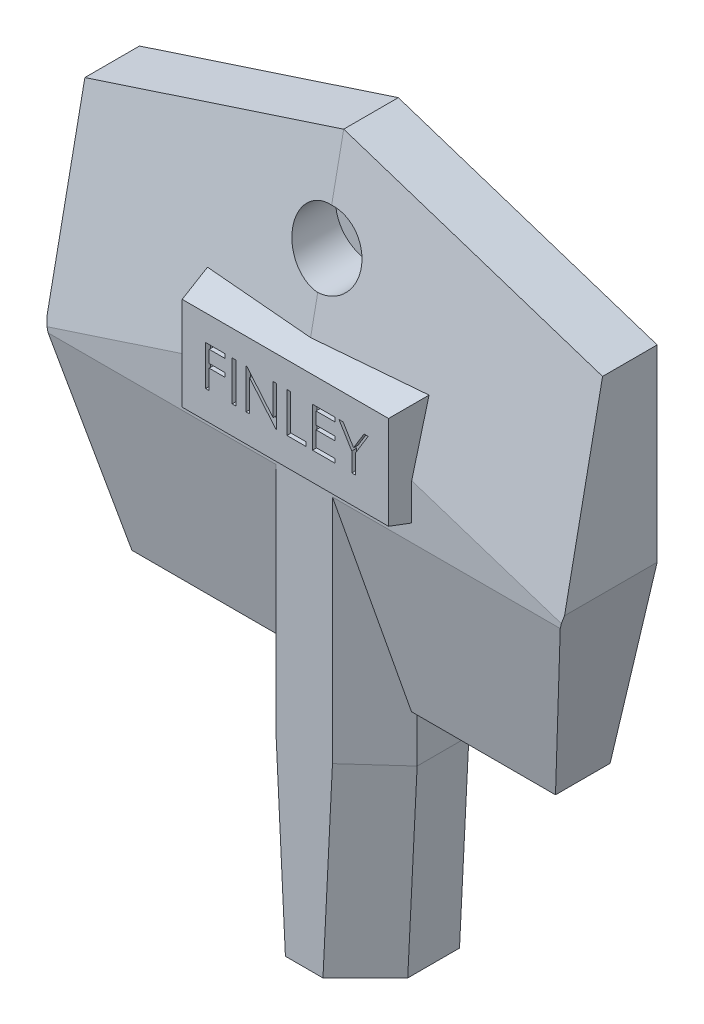
from build123d import *

# Parameters (mm, degrees)
BOSS_EXTRUDE1_DEPTH  = 10
SKETCH3_OUTSIDE_W    = 75.708
SKETCH3_OUTSIDE_H    = 95.708
SHAPE_CUTS_DEPTH     = 58.933151131
DOVE_TAIL_DEPTH      = 30
SKETCH5_R            = 2.05
FASTENER_DEPTH       = 58.933151131
SKETCH7_R            = 3.65
CUT_EXTRUDE4_DEPTH   = 7
SKETCH8_W            = 24
SKETCH8_H            = 12
NAMES_PLATE_DEPTH    = 2
CHAMFER1_SIZE        = 4.2
CHAMFER1_SIZE_2      = 19.75944646
CHAMFER2_SIZE        = 4.5
CHAMFER3_SIZE        = 4.5
CHAMFER3_SIZE_2      = 1.03890686
SKETCH9_W            = 0.379914529
SKETCH9_H            = 4.233333333
AVA_NAME_PRINT_DEPTH = 0.5


with BuildPart() as part:
    # Sketch2 → Boss-Extrude1 (new body)
    with BuildSketch(Plane.XY):
        Polygon((7.5, 0), (27.5, 0), (27.5, 50), (-27.5, 50), (-27.5, 0), (-7.5, 0), (-7.5, -25), (7.5, -25), align=None)
    extrude(amount=BOSS_EXTRUDE1_DEPTH)

    # Sketch3 outside → Shape cuts (cut, through all)
    with BuildSketch(Plane.XY.offset(10)):
        with Locations((0, 12.5)):
            Rectangle(SKETCH3_OUTSIDE_W, SKETCH3_OUTSIDE_H)
        Polygon((-6.5, -25), (-7.5, -5), (-7.5, 0), (-22.5, 0), (-27.5, 21), (-27.5, 41), (0, 50), (27.5, 41), (27.5, 21), (22.5, 0), (7.5, 0), (7.5, -5), (6.5, -25), align=None, mode=Mode.SUBTRACT)
    extrude(amount=-SHAPE_CUTS_DEPTH, mode=Mode.SUBTRACT)

    # Sketch4 → Dove tail (cut)
    with BuildSketch(Plane.XZ.offset(25)):
        Polygon((-5, 5), (5, 5), (3, 0), (-3, 0), align=None)
    extrude(amount=-DOVE_TAIL_DEPTH, mode=Mode.SUBTRACT)

    # Sketch5 → Fastener (cut, through all)
    with BuildSketch(Plane(origin=(0, 0, 0), x_dir=(-1, 0, 0), z_dir=(0, 0, -1))):
        with Locations((0, 40)):
            Circle(SKETCH5_R)
    extrude(amount=-FASTENER_DEPTH, mode=Mode.SUBTRACT)

    # Sketch7 → Cut-Extrude4 (cut)
    with BuildSketch(Plane.XY.offset(10)):
        with Locations((0, 40)):
            Circle(SKETCH7_R)
    extrude(amount=-CUT_EXTRUDE4_DEPTH, mode=Mode.SUBTRACT)

    # Sketch8 → Names Plate (add)
    with BuildSketch(Plane.XY.offset(10)):
        with Locations((0, 27)):
            Rectangle(SKETCH8_W, SKETCH8_H)
    extrude(amount=NAMES_PLATE_DEPTH)

    # Chamfer1
    # the kernel refuses this chamfer: 19.75944646, 4.2 mm, written as the material it takes off along each edge
    with BuildSketch(Plane(origin=(-43.83302561, 0, 10), x_dir=(0, -0.17442650951506392, -0.9846701949274139), z_dir=(1, 0, 0))) as chamfer1_piece_1_section:
        Polygon((CHAMFER1_SIZE * 0.984670194927, CHAMFER1_SIZE * 0.174426509515), (-CHAMFER1_SIZE_2 * 0.174426509513, CHAMFER1_SIZE_2 * 0.984670194918), (0, 0), align=None)
    chamfer1_piece_1 = extrude(amount=117.66605122, mode=Mode.PRIVATE)
    chamfer1_piece_1 = split(chamfer1_piece_1, bisect_by=Plane(origin=(-7.5, 6.987243294, 8.814531777), z_dir=(-1, 0, 0)), keep=Keep.TOP, mode=Mode.PRIVATE)
    add(chamfer1_piece_1, mode=Mode.SUBTRACT)
    with BuildSketch(Plane(origin=(7.5, 0, 10), x_dir=(0, -0.17442650951506392, -0.9846701949274139), z_dir=(1, 0, 0))) as chamfer1_piece_2:
        Polygon((CHAMFER1_SIZE * 0.984670194927, CHAMFER1_SIZE * 0.174426509515), (-CHAMFER1_SIZE_2 * 0.174426509513, CHAMFER1_SIZE_2 * 0.984670194918), (0, 0), align=None)
    extrude(amount=66.33302561, mode=Mode.SUBTRACT)
    with BuildSketch(Plane(origin=(-73.83302561, 0, 10), x_dir=(0, 0.9999679748920759, 0.008003073799517023), z_dir=(1, 0, 0))) as chamfer1_piece_3:
        Polygon((CHAMFER1_SIZE_2 * 0.999967974882, -CHAMFER1_SIZE_2 * 0.00800307379944), (-CHAMFER1_SIZE * 0.00800307379952, -CHAMFER1_SIZE * 0.999967974892), (0, 0), align=None)
    extrude(amount=66.33302561, mode=Mode.SUBTRACT)
    with BuildSketch(Plane(origin=(-73.83302561, 0, 10), x_dir=(0, 0.9999679748920759, 0.008003073799517023), z_dir=(1, 0, 0))) as chamfer1_piece_4_section:
        Polygon((CHAMFER1_SIZE_2 * 0.999967974882, -CHAMFER1_SIZE_2 * 0.00800307379944), (-CHAMFER1_SIZE * 0.00800307379952, -CHAMFER1_SIZE * 0.999967974892), (0, 0), align=None)
    chamfer1_piece_4 = extrude(amount=117.66605122, mode=Mode.PRIVATE)
    chamfer1_piece_4 = split(chamfer1_piece_4, bisect_by=Plane(origin=(7.5, 6.987243294, 8.814531777), z_dir=(1, 0, 0)), keep=Keep.TOP, mode=Mode.PRIVATE)
    add(chamfer1_piece_4, mode=Mode.SUBTRACT)
    with BuildSketch(Plane(origin=(-76.286760165, 25.033423946, 10), x_dir=(0.3110290993551473, -0.9503666924740605, 0.008003073799517025), z_dir=(0.9503971290446889, 0.31103906041462565, 0))) as chamfer1_piece_5_section:
        Polygon((CHAMFER1_SIZE_2 * 0.999967974882, CHAMFER1_SIZE_2 * 0.00800307379944), (-CHAMFER1_SIZE * 0.00800307379952, CHAMFER1_SIZE * 0.999967974892), (0, 0), align=None)
    chamfer1_piece_5 = extrude(amount=131.601323812, mode=Mode.PRIVATE)
    chamfer1_piece_5 = split(chamfer1_piece_5, bisect_by=Plane(origin=(-50.474654782, 33, 8.986769107), z_dir=(0, -1, 0)), keep=Keep.TOP, mode=Mode.PRIVATE)
    chamfer1_piece_5 = split(chamfer1_piece_5, bisect_by=Plane(origin=(-12, 24.582378236, 8.986769107), z_dir=(-1, 0, 0)), keep=Keep.TOP, mode=Mode.PRIVATE)
    add(chamfer1_piece_5, mode=Mode.SUBTRACT)
    with BuildSketch(Plane(origin=(-76.286760165, 25.033423946, 10), x_dir=(0.3110290993551473, -0.9503666924740605, 0.008003073799517025), z_dir=(0.9503971290446889, 0.31103906041462565, 0))) as chamfer1_piece_6_section:
        Polygon((CHAMFER1_SIZE_2 * 0.999967974882, CHAMFER1_SIZE_2 * 0.00800307379944), (-CHAMFER1_SIZE * 0.00800307379952, CHAMFER1_SIZE * 0.999967974892), (0, 0), align=None)
    chamfer1_piece_6 = extrude(amount=131.601323812, mode=Mode.PRIVATE)
    chamfer1_piece_6 = split(chamfer1_piece_6, bisect_by=Plane(origin=(-26.699133226, 33, 8.380574439), z_dir=(0, 1, 0)), keep=Keep.TOP, mode=Mode.PRIVATE)
    chamfer1_piece_6 = split(chamfer1_piece_6, bisect_by=Plane(origin=(-12, 37.810625419, 8.380574439), z_dir=(-1, 0, 0)), keep=Keep.TOP, mode=Mode.PRIVATE)
    add(chamfer1_piece_6, mode=Mode.SUBTRACT)
    with BuildSketch(Plane(origin=(-76.286760165, 25.033423946, 10), x_dir=(0.3110290993551473, -0.9503666924740605, 0.008003073799517025), z_dir=(0.9503971290446889, 0.31103906041462565, 0))) as chamfer1_piece_7_section:
        Polygon((CHAMFER1_SIZE_2 * 0.999967974882, CHAMFER1_SIZE_2 * 0.00800307379944), (-CHAMFER1_SIZE * 0.00800307379952, CHAMFER1_SIZE * 0.999967974892), (0, 0), align=None)
    chamfer1_piece_7 = extrude(amount=131.601323812, mode=Mode.PRIVATE)
    chamfer1_piece_7 = split(chamfer1_piece_7, bisect_by=Plane(origin=(20.226611315, 33, 8.796706838), z_dir=(0, 1, 0)), keep=Keep.TOP, mode=Mode.PRIVATE)
    chamfer1_piece_7 = split(chamfer1_piece_7, bisect_by=Plane(origin=(-12, 49.436791762, 8.796706838), z_dir=(1, 0, 0)), keep=Keep.TOP, mode=Mode.PRIVATE)
    add(chamfer1_piece_7, mode=Mode.SUBTRACT)
    with BuildSketch(Plane(origin=(-48.786760165, 65.966576054, 10), x_dir=(-0.3110290993551472, -0.9503666924740605, 0.008003073799517025), z_dir=(0.9503971290446889, -0.31103906041462565, 0))) as chamfer1_piece_8_section:
        Polygon((CHAMFER1_SIZE_2 * 0.999967974882, CHAMFER1_SIZE_2 * 0.00800307379944), (-CHAMFER1_SIZE * 0.00800307379952, CHAMFER1_SIZE * 0.999967974892), (0, 0), align=None)
    chamfer1_piece_8 = extrude(amount=131.601323812, mode=Mode.PRIVATE)
    chamfer1_piece_8 = split(chamfer1_piece_8, bisect_by=Plane(origin=(12, 49.436791762, 8.796706838), z_dir=(-1, 0, 0)), keep=Keep.TOP, mode=Mode.PRIVATE)
    chamfer1_piece_8 = split(chamfer1_piece_8, bisect_by=Plane(origin=(-20.226611315, 33, 8.796706838), z_dir=(0, 1, 0)), keep=Keep.TOP, mode=Mode.PRIVATE)
    add(chamfer1_piece_8, mode=Mode.SUBTRACT)
    with BuildSketch(Plane(origin=(-48.786760165, 65.966576054, 10), x_dir=(-0.3110290993551472, -0.9503666924740605, 0.008003073799517025), z_dir=(0.9503971290446889, -0.31103906041462565, 0))) as chamfer1_piece_9_section:
        Polygon((CHAMFER1_SIZE_2 * 0.999967974882, CHAMFER1_SIZE_2 * 0.00800307379944), (-CHAMFER1_SIZE * 0.00800307379952, CHAMFER1_SIZE * 0.999967974892), (0, 0), align=None)
    chamfer1_piece_9 = extrude(amount=131.601323812, mode=Mode.PRIVATE)
    chamfer1_piece_9 = split(chamfer1_piece_9, bisect_by=Plane(origin=(12, 37.810625419, 8.380574439), z_dir=(1, 0, 0)), keep=Keep.TOP, mode=Mode.PRIVATE)
    chamfer1_piece_9 = split(chamfer1_piece_9, bisect_by=Plane(origin=(26.699133226, 33, 8.380574439), z_dir=(0, 1, 0)), keep=Keep.TOP, mode=Mode.PRIVATE)
    add(chamfer1_piece_9, mode=Mode.SUBTRACT)
    with BuildSketch(Plane(origin=(-48.786760165, 65.966576054, 10), x_dir=(-0.3110290993551472, -0.9503666924740605, 0.008003073799517025), z_dir=(0.9503971290446889, -0.31103906041462565, 0))) as chamfer1_piece_10_section:
        Polygon((CHAMFER1_SIZE_2 * 0.999967974882, CHAMFER1_SIZE_2 * 0.00800307379944), (-CHAMFER1_SIZE * 0.00800307379952, CHAMFER1_SIZE * 0.999967974892), (0, 0), align=None)
    chamfer1_piece_10 = extrude(amount=131.601323812, mode=Mode.PRIVATE)
    chamfer1_piece_10 = split(chamfer1_piece_10, bisect_by=Plane(origin=(12, 24.582378236, 8.986769107), z_dir=(1, 0, 0)), keep=Keep.TOP, mode=Mode.PRIVATE)
    chamfer1_piece_10 = split(chamfer1_piece_10, bisect_by=Plane(origin=(50.474654782, 33, 8.986769107), z_dir=(0, -1, 0)), keep=Keep.TOP, mode=Mode.PRIVATE)
    add(chamfer1_piece_10, mode=Mode.SUBTRACT)

    # Chamfer2
    # the kernel refuses this chamfer: 4.5 mm, written as the material it adds along each edge
    # the kernel refuses this chamfer: 4.5 mm, written as the material it takes off along each edge
    with BuildSketch(Plane(origin=(-7.5, 31.332019906, 10), x_dir=(0.9996219169112966, 8.91002913121734e-15, 0.02749587661058639), z_dir=(0, -1, 0))) as chamfer2_2_piece_1_section:
        Polygon((CHAMFER2_SIZE * 0.999621916911, -CHAMFER2_SIZE * 0.0274958766106), (-CHAMFER2_SIZE * 0.0274958766106, -CHAMFER2_SIZE * 0.999621916911), (0, 0), align=None)
    chamfer2_2_piece_1 = extrude(amount=47.904593352, mode=Mode.PRIVATE)
    chamfer2_2_piece_1 = split(chamfer2_2_piece_1, bisect_by=Plane(origin=(-7.425, 0, 5.65), z_dir=(0, -1, 0)), keep=Keep.TOP, mode=Mode.PRIVATE)
    add(chamfer2_2_piece_1, mode=Mode.SUBTRACT)
    with BuildSketch(Plane(origin=(-7.5, 31.332019906, 10), x_dir=(0.9996219169112966, 8.91002913121734e-15, 0.02749587661058639), z_dir=(0, -1, 0))) as chamfer2_2_piece_2_section:
        Polygon((CHAMFER2_SIZE * 0.999621916911, -CHAMFER2_SIZE * 0.0274958766106), (-CHAMFER2_SIZE * 0.0274958766106, -CHAMFER2_SIZE * 0.999621916911), (0, 0), align=None)
    chamfer2_2_piece_2 = extrude(amount=47.904593352, mode=Mode.PRIVATE)
    chamfer2_2_piece_2 = split(chamfer2_2_piece_2, bisect_by=Plane(origin=(-5.791935484, 7.646978201, 7.425415393), z_dir=(0, -0.20791169081730007, 0.9781476007339034)), keep=Keep.TOP, mode=Mode.PRIVATE)
    add(chamfer2_2_piece_2, mode=Mode.SUBTRACT)
    with BuildSketch(Plane(origin=(7.5, 31.332019906, 10), x_dir=(0.02749587661058639, 1.490299200723227e-13, -0.9996219169112966), z_dir=(0, -1, 0))) as chamfer2_2_piece_3_section:
        Polygon((CHAMFER2_SIZE * 0.999621916911, -CHAMFER2_SIZE * 0.0274958766106), (-CHAMFER2_SIZE * 0.0274958766106, -CHAMFER2_SIZE * 0.999621916911), (0, 0), align=None)
    chamfer2_2_piece_3 = extrude(amount=47.904593351, mode=Mode.PRIVATE)
    chamfer2_2_piece_3 = split(chamfer2_2_piece_3, bisect_by=Plane(origin=(5.791935484, 7.646978201, 7.425415393), z_dir=(0, -0.20791169081730007, 0.9781476007339034)), keep=Keep.TOP, mode=Mode.PRIVATE)
    add(chamfer2_2_piece_3, mode=Mode.SUBTRACT)
    with BuildSketch(Plane(origin=(7.5, 31.332019906, 10), x_dir=(0.02749587661058639, 1.490299200723227e-13, -0.9996219169112966), z_dir=(0, -1, 0))) as chamfer2_2_piece_4_section:
        Polygon((CHAMFER2_SIZE * 0.999621916911, -CHAMFER2_SIZE * 0.0274958766106), (-CHAMFER2_SIZE * 0.0274958766106, -CHAMFER2_SIZE * 0.999621916911), (0, 0), align=None)
    chamfer2_2_piece_4 = extrude(amount=47.904593351, mode=Mode.PRIVATE)
    chamfer2_2_piece_4 = split(chamfer2_2_piece_4, bisect_by=Plane(origin=(7.425, 0, 5.65), z_dir=(0, -1, 0)), keep=Keep.TOP, mode=Mode.PRIVATE)
    add(chamfer2_2_piece_4, mode=Mode.SUBTRACT)
    with BuildSketch(Plane(origin=(-5.92209326, -36.558134796, 10), x_dir=(0.9983747275087121, 0.04991873637543544, 0.02749587661058639), z_dir=(-0.049937616943892066, 0.9987523388778448, 0))) as chamfer2_2_piece_5_section:
        Polygon((CHAMFER2_SIZE * 0.999621916911, CHAMFER2_SIZE * 0.0274958766106), (-CHAMFER2_SIZE * 0.0274958766106, CHAMFER2_SIZE * 0.999621916911), (0, 0), align=None)
    chamfer2_2_piece_5 = extrude(amount=43.170131286, mode=Mode.PRIVATE)
    chamfer2_2_piece_5 = split(chamfer2_2_piece_5, bisect_by=Plane(origin=(-5.601535176, -11.523039788, 3.350702283), z_dir=(0, -0.20791169081730007, 0.9781476007339034)), keep=Keep.TOP, mode=Mode.PRIVATE)
    add(chamfer2_2_piece_5, mode=Mode.SUBTRACT)
    with BuildSketch(Plane(origin=(-5.92209326, -36.558134796, 10), x_dir=(0.9983747275087121, 0.04991873637543544, 0.02749587661058639), z_dir=(-0.049937616943892066, 0.9987523388778448, 0))) as chamfer2_2_piece_6_section:
        Polygon((CHAMFER2_SIZE * 0.999621916911, CHAMFER2_SIZE * 0.0274958766106), (-CHAMFER2_SIZE * 0.0274958766106, CHAMFER2_SIZE * 0.999621916911), (0, 0), align=None)
    chamfer2_2_piece_6 = extrude(amount=43.170131286, mode=Mode.PRIVATE)
    chamfer2_2_piece_6 = split(chamfer2_2_piece_6, bisect_by=Plane(origin=(-7.487406309, 0, 5.770981551), z_dir=(0, -1, 0)), keep=Keep.TOP, mode=Mode.PRIVATE)
    add(chamfer2_2_piece_6, mode=Mode.SUBTRACT)
    with BuildSketch(Plane(origin=(8.07790674, 6.558134796, 10), x_dir=(-0.9983747275087121, 0.04991873637543566, 0.02749587661058639), z_dir=(-0.04993761694389229, -0.9987523388778448, 0))) as chamfer2_2_piece_7_section:
        Polygon((CHAMFER2_SIZE * 0.999621916911, CHAMFER2_SIZE * 0.0274958766106), (-CHAMFER2_SIZE * 0.0274958766106, CHAMFER2_SIZE * 0.999621916911), (0, 0), align=None)
    chamfer2_2_piece_7 = extrude(amount=43.170131286, mode=Mode.PRIVATE)
    chamfer2_2_piece_7 = split(chamfer2_2_piece_7, bisect_by=Plane(origin=(6.100176862, 3.64296483, 6.574336079), z_dir=(0, -0.20791169081730007, 0.9781476007339034)), keep=Keep.TOP, mode=Mode.PRIVATE)
    add(chamfer2_2_piece_7, mode=Mode.SUBTRACT)
    with BuildSketch(Plane(origin=(8.07790674, 6.558134796, 10), x_dir=(-0.9983747275087121, 0.04991873637543566, 0.02749587661058639), z_dir=(-0.04993761694389229, -0.9987523388778448, 0))) as chamfer2_2_piece_8_section:
        Polygon((CHAMFER2_SIZE * 0.999621916911, CHAMFER2_SIZE * 0.0274958766106), (-CHAMFER2_SIZE * 0.0274958766106, CHAMFER2_SIZE * 0.999621916911), (0, 0), align=None)
    chamfer2_2_piece_8 = extrude(amount=43.170131286, mode=Mode.PRIVATE)
    chamfer2_2_piece_8 = split(chamfer2_2_piece_8, bisect_by=Plane(origin=(7.487406309, 0, 5.770981551), z_dir=(0, -1, 0)), keep=Keep.TOP, mode=Mode.PRIVATE)
    add(chamfer2_2_piece_8, mode=Mode.SUBTRACT)

    # Chamfer3
    # the kernel refuses this chamfer: 4.5, 1.03890686 mm, written as the material it takes off along each edge
    with BuildSketch(Plane(origin=(-23.688904863, 33, 12), x_dir=(0, 0.008660176093277927, -0.9999624999718906), z_dir=(1, 0, 0))) as chamfer3_piece_1_section:
        Polygon((CHAMFER3_SIZE * 0.999962499972, -CHAMFER3_SIZE * 0.00866017609328), (-CHAMFER3_SIZE_2 * 0.00866017609382, -CHAMFER3_SIZE_2 * 0.999962500034), (0, 0), align=None)
    chamfer3_piece_1 = extrude(amount=47.377809727, mode=Mode.PRIVATE)
    chamfer3_piece_1 = split(chamfer3_piece_1, bisect_by=Plane(origin=(-15.747387657, 32.981610324, 10.27905167), z_dir=(-0.06466865696139155, -0.19759867404852308, -0.9781476007336907)), keep=Keep.TOP, mode=Mode.PRIVATE)
    chamfer3_piece_1 = split(chamfer3_piece_1, bisect_by=Plane(origin=(-15.724323898, 32.577762011, 8.279932697), z_dir=(-0.06466865696139155, 0.19759867404852308, 0.9781476007336907)), keep=Keep.TOP, mode=Mode.PRIVATE)
    add(chamfer3_piece_1, mode=Mode.SUBTRACT)
    with BuildSketch(Plane(origin=(-23.688904863, 33, 12), x_dir=(0, 0.008660176093277927, -0.9999624999718906), z_dir=(1, 0, 0))) as chamfer3_piece_2_section:
        Polygon((CHAMFER3_SIZE * 0.999962499972, -CHAMFER3_SIZE * 0.00866017609328), (-CHAMFER3_SIZE_2 * 0.00866017609382, -CHAMFER3_SIZE_2 * 0.999962500034), (0, 0), align=None)
    chamfer3_piece_2 = extrude(amount=47.377809727, mode=Mode.PRIVATE)
    chamfer3_piece_2 = split(chamfer3_piece_2, bisect_by=Plane(origin=(15.724323898, 32.577762011, 8.279932697), z_dir=(0.06466865696139155, 0.19759867404852308, 0.9781476007336907)), keep=Keep.TOP, mode=Mode.PRIVATE)
    chamfer3_piece_2 = split(chamfer3_piece_2, bisect_by=Plane(origin=(15.747387657, 32.981610324, 10.27905167), z_dir=(0.06466865696139155, -0.19759867404852308, -0.9781476007336907)), keep=Keep.TOP, mode=Mode.PRIVATE)
    add(chamfer3_piece_2, mode=Mode.SUBTRACT)
    with BuildSketch(Plane(origin=(-23.688904863, 33, 12), x_dir=(0, 0.008660176093277927, -0.9999624999718906), z_dir=(1, 0, 0))) as chamfer3_piece_3_section:
        Polygon((CHAMFER3_SIZE * 0.999962499972, -CHAMFER3_SIZE * 0.00866017609328), (-CHAMFER3_SIZE_2 * 0.00866017609382, -CHAMFER3_SIZE_2 * 0.999962500034), (0, 0), align=None)
    chamfer3_piece_3 = extrude(amount=47.377809727, mode=Mode.PRIVATE)
    chamfer3_piece_3 = split(chamfer3_piece_3, bisect_by=Plane(origin=(-0.116574835, 32.257698924, 9.391885215), z_dir=(0.06466865696139155, 0.19759867404852308, 0.9781476007336907)), keep=Keep.TOP, mode=Mode.PRIVATE)
    chamfer3_piece_3 = split(chamfer3_piece_3, bisect_by=Plane(origin=(0.116574835, 32.257698924, 9.391885215), z_dir=(-0.06466865696139155, 0.19759867404852308, 0.9781476007336907)), keep=Keep.TOP, mode=Mode.PRIVATE)
    add(chamfer3_piece_3, mode=Mode.SUBTRACT)
    with BuildSketch(Plane(origin=(12, 44.688904863, 12), x_dir=(-0.9870549888826571, 0, 0.1603821963992814), z_dir=(0, -1, 0))) as chamfer3_piece_4_section:
        Polygon((CHAMFER3_SIZE_2 * 0.987054988944, CHAMFER3_SIZE_2 * 0.160382196409), (-CHAMFER3_SIZE * 0.160382196399, CHAMFER3_SIZE * 0.987054988883), (0, 0), align=None)
    chamfer3_piece_4 = extrude(amount=35.377809727, mode=Mode.PRIVATE)
    chamfer3_piece_4 = split(chamfer3_piece_4, bisect_by=Plane(origin=(11.440207801, 31.525379387, 8.775765274), z_dir=(0.06466865696139155, 0.19759867404852308, 0.9781476007336907)), keep=Keep.TOP, mode=Mode.PRIVATE)
    chamfer3_piece_4 = split(chamfer3_piece_4, bisect_by=Plane(origin=(11.602096163, 32.020038273, 10), z_dir=(0, 0, 1)), keep=Keep.TOP, mode=Mode.PRIVATE)
    add(chamfer3_piece_4, mode=Mode.SUBTRACT)
    with BuildSketch(Plane(origin=(12, 44.688904863, 12), x_dir=(-0.9870549888826571, 0, 0.1603821963992814), z_dir=(0, -1, 0))) as chamfer3_piece_5_section:
        Polygon((CHAMFER3_SIZE_2 * 0.987054988944, CHAMFER3_SIZE_2 * 0.160382196409), (-CHAMFER3_SIZE * 0.160382196399, CHAMFER3_SIZE * 0.987054988883), (0, 0), align=None)
    chamfer3_piece_5 = extrude(amount=35.377809727, mode=Mode.PRIVATE)
    chamfer3_piece_5 = split(chamfer3_piece_5, bisect_by=Plane(origin=(11.75860092, 36.766980835, 7.695842826), z_dir=(0.06466865696139155, 0.19759867404852308, 0.9781476007336907)), keep=Keep.TOP, mode=Mode.PRIVATE)
    chamfer3_piece_5 = split(chamfer3_piece_5, bisect_by=Plane(origin=(11.856026743, 37.064670851, 10), z_dir=(0, 0, -1)), keep=Keep.TOP, mode=Mode.PRIVATE)
    add(chamfer3_piece_5, mode=Mode.SUBTRACT)
    with BuildSketch(Plane(origin=(12, 44.688904863, 12), x_dir=(-0.9870549888826571, 0, 0.1603821963992814), z_dir=(0, -1, 0))) as chamfer3_piece_6_section:
        Polygon((CHAMFER3_SIZE_2 * 0.987054988944, CHAMFER3_SIZE_2 * 0.160382196409), (-CHAMFER3_SIZE * 0.160382196399, CHAMFER3_SIZE * 0.987054988883), (0, 0), align=None)
    chamfer3_piece_6 = extrude(amount=35.377809727, mode=Mode.PRIVATE)
    chamfer3_piece_6 = split(chamfer3_piece_6, bisect_by=Plane(origin=(11.705305569, 15.149533813, 12.066374843), z_dir=(-0.06466865696139155, -0.19759867404852308, -0.9781476007336907)), keep=Keep.TOP, mode=Mode.PRIVATE)
    chamfer3_piece_6 = split(chamfer3_piece_6, bisect_by=Plane(origin=(11.633502975, 14.930136998, 10), z_dir=(0, 0, 1)), keep=Keep.TOP, mode=Mode.PRIVATE)
    add(chamfer3_piece_6, mode=Mode.SUBTRACT)
    with BuildSketch(Plane(origin=(23.688904863, 21, 12), x_dir=(0, -0.008660176093277927, -0.9999624999718906), z_dir=(-1, 0, 0))) as chamfer3_piece_7_section:
        Polygon((CHAMFER3_SIZE * 0.999962499972, -CHAMFER3_SIZE * 0.00866017609328), (-CHAMFER3_SIZE_2 * 0.00866017609382, -CHAMFER3_SIZE_2 * 0.999962500034), (0, 0), align=None)
    chamfer3_piece_7 = extrude(amount=47.377809727, mode=Mode.PRIVATE)
    chamfer3_piece_7 = split(chamfer3_piece_7, bisect_by=Plane(origin=(0, 21.388678307, 10), z_dir=(0, 0, 1)), keep=Keep.TOP, mode=Mode.PRIVATE)
    add(chamfer3_piece_7, mode=Mode.SUBTRACT)
    with BuildSketch(Plane(origin=(-12, 9.311095137, 12), x_dir=(-0.008660176093277927, 0, -0.9999624999718906), z_dir=(0, 1, 0))) as chamfer3_piece_8_section:
        Polygon((CHAMFER3_SIZE * 0.999962499972, -CHAMFER3_SIZE * 0.00866017609328), (-CHAMFER3_SIZE_2 * 0.00866017609382, -CHAMFER3_SIZE_2 * 0.999962500034), (0, 0), align=None)
    chamfer3_piece_8 = extrude(amount=35.377809727, mode=Mode.PRIVATE)
    chamfer3_piece_8 = split(chamfer3_piece_8, bisect_by=Plane(origin=(-11.705305569, 15.149533813, 12.066374843), z_dir=(0.06466865696139155, -0.19759867404852308, -0.9781476007336907)), keep=Keep.TOP, mode=Mode.PRIVATE)
    chamfer3_piece_8 = split(chamfer3_piece_8, bisect_by=Plane(origin=(-11.633502975, 14.930136998, 10), z_dir=(0, 0, 1)), keep=Keep.TOP, mode=Mode.PRIVATE)
    add(chamfer3_piece_8, mode=Mode.SUBTRACT)
    with BuildSketch(Plane(origin=(-12, 9.311095137, 12), x_dir=(-0.008660176093277927, 0, -0.9999624999718906), z_dir=(0, 1, 0))) as chamfer3_piece_9_section:
        Polygon((CHAMFER3_SIZE * 0.999962499972, -CHAMFER3_SIZE * 0.00866017609328), (-CHAMFER3_SIZE_2 * 0.00866017609382, -CHAMFER3_SIZE_2 * 0.999962500034), (0, 0), align=None)
    chamfer3_piece_9 = extrude(amount=35.377809727, mode=Mode.PRIVATE)
    chamfer3_piece_9 = split(chamfer3_piece_9, bisect_by=Plane(origin=(-11.75860092, 36.766980835, 7.695842826), z_dir=(-0.06466865696139155, 0.19759867404852308, 0.9781476007336907)), keep=Keep.TOP, mode=Mode.PRIVATE)
    chamfer3_piece_9 = split(chamfer3_piece_9, bisect_by=Plane(origin=(-11.856026743, 37.064670851, 10), z_dir=(0, 0, -1)), keep=Keep.TOP, mode=Mode.PRIVATE)
    add(chamfer3_piece_9, mode=Mode.SUBTRACT)
    with BuildSketch(Plane(origin=(-12, 9.311095137, 12), x_dir=(-0.008660176093277927, 0, -0.9999624999718906), z_dir=(0, 1, 0))) as chamfer3_piece_10_section:
        Polygon((CHAMFER3_SIZE * 0.999962499972, -CHAMFER3_SIZE * 0.00866017609328), (-CHAMFER3_SIZE_2 * 0.00866017609382, -CHAMFER3_SIZE_2 * 0.999962500034), (0, 0), align=None)
    chamfer3_piece_10 = extrude(amount=35.377809727, mode=Mode.PRIVATE)
    chamfer3_piece_10 = split(chamfer3_piece_10, bisect_by=Plane(origin=(-11.440207801, 31.525379387, 8.775765274), z_dir=(-0.06466865696139155, 0.19759867404852308, 0.9781476007336907)), keep=Keep.TOP, mode=Mode.PRIVATE)
    chamfer3_piece_10 = split(chamfer3_piece_10, bisect_by=Plane(origin=(-11.602096163, 32.020038273, 10), z_dir=(0, 0, 1)), keep=Keep.TOP, mode=Mode.PRIVATE)
    add(chamfer3_piece_10, mode=Mode.SUBTRACT)

    # Sketch9 → AVA name print (cut)
    with BuildSketch(Plane.XY.offset(12)):
        Polygon((-8.466666667, 29.233333333), (-6.404273504, 29.233333333), (-6.404273504, 28.799145299), (-8.086752137, 28.799145299), (-8.086752137, 27.496581197), (-6.404273504, 27.496581197), (-6.404273504, 27.062393162), (-8.086752137, 27.062393162), (-8.086752137, 25), (-8.466666667, 25), align=None)
        with Locations((-5.45448718, 27.116666667)):
            Rectangle(SKETCH9_W, SKETCH9_H)
        Polygon((-4.179059829, 25), (-4.179059829, 29.233333333), (-4.09934562, 29.233333333), (-1.302564103, 25.901448985), (-1.302564103, 29.233333333), (-0.922649573, 29.233333333), (-0.922649573, 25), (-1.00914797, 25), (-3.799145299, 28.324252137), (-3.799145299, 25), align=None)
        Polygon((0.162820513, 29.233333333), (0.542735043, 29.233333333), (0.542735043, 25.434188034), (2.170940171, 25.434188034), (2.170940171, 25), (0.162820513, 25), align=None)
        Polygon((2.876495726, 29.233333333), (5.264529915, 29.233333333), (5.264529915, 28.799145299), (3.256410256, 28.799145299), (3.256410256, 27.496581197), (5.264529915, 27.496581197), (5.264529915, 27.062393162), (3.256410256, 27.062393162), (3.256410256, 25.434188034), (5.264529915, 25.434188034), (5.264529915, 25), (2.876495726, 25), align=None)
        Polygon((5.698717949, 29.233333333), (6.133754006, 29.233333333), (7.246360844, 27.414322917), (8.357271635, 29.233333333), (8.792307692, 29.233333333), (7.435470085, 27.012359776), (7.435470085, 25), (7.055555556, 25), (7.055555556, 27.012359776), align=None)
    extrude(amount=-AVA_NAME_PRINT_DEPTH, mode=Mode.SUBTRACT)


solid = part.part
